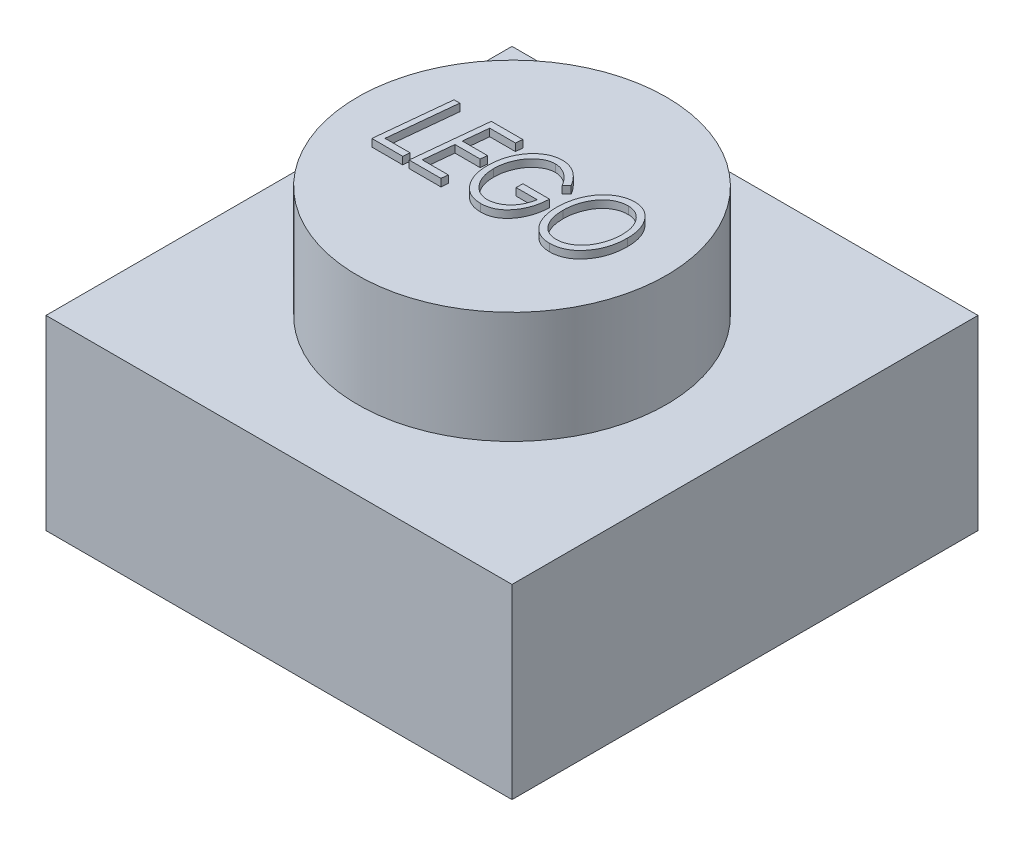
from build123d import *

# Parameters (mm, degrees)
SKETCH2_W           = 7.9375
SKETCH2_H           = 7.9375
BOSS_EXTRUDE3_DEPTH = 3.175
SKETCH3_R           = 2.630752939
BOSS_EXTRUDE4_DEPTH = 1.905
SHELL1_OUTLINE_W    = 4.8895
SHELL1_OUTLINE_H    = 4.8895
SHELL1_DEPTH        = 2.1082
SHELL1_START        = 2.1082
SHELL1_2_OUTLINE_R  = 1.106752939
SHELL1_2_DEPTH      = 1.4478
BOSS_EXTRUDE5_DEPTH = 0.127


# Read off the part's stored shape, not the designer's step: Shell1
with BuildPart() as part:
    # Sketch2 → Boss-Extrude3 (new body)
    with BuildSketch(Plane(origin=(0, 0, 0), x_dir=(1, 0, 0), z_dir=(0, 1, 0))):
        with Locations((-5.826863381, 4.754641089)):
            Rectangle(SKETCH2_W, SKETCH2_H)
    extrude(amount=BOSS_EXTRUDE3_DEPTH)

    # Sketch3 → Boss-Extrude4 (add)
    with BuildSketch(Plane(origin=(0, 3.175, 0), x_dir=(1, 0, 0), z_dir=(0, 1, 0))):
        with Locations(Location((-5.826863381, 4.754641089, 0), (0, 0, 90))):
            Circle(SKETCH3_R)
    extrude(amount=BOSS_EXTRUDE4_DEPTH)

    # Shell1 outline → Shell1 (cut)
    with BuildSketch(Plane(origin=(0, 0, 0), x_dir=(1, 0, 0), z_dir=(0, 1, 0))):
        with Locations((-5.826863381, 4.754641089)):
            Rectangle(SHELL1_OUTLINE_W, SHELL1_OUTLINE_H)
    extrude(amount=SHELL1_DEPTH, mode=Mode.SUBTRACT)

    # Shell1 2 outline → Shell1 2 (cut)
    with BuildSketch(Plane(origin=(0, 0, 0), x_dir=(1, 0, 0), z_dir=(0, 1, 0)).offset(SHELL1_START)):
        with Locations((-5.826863381, 4.754641089)):
            Circle(SHELL1_2_OUTLINE_R)
    extrude(amount=SHELL1_2_DEPTH, mode=Mode.SUBTRACT)

    # Sketch4 → Boss-Extrude5 (add)
    # profile 1 of 4: a face of its own
    with BuildSketch(Plane(origin=(0, 5.08, 0), x_dir=(1, 0, 0), z_dir=(0, 1, 0))):
        Polygon((-7.469023625, 5.408916057), (-7.370568096, 5.408916057), (-7.488358561, 4.252890416), (-7.061209122, 4.252890416), (-7.072403032, 4.138916057), (-7.598516814, 4.138916057), align=None)
    # profile 2 of 4: a face of its own
    with BuildSketch(Plane(origin=(0, 5.08, 0), x_dir=(1, 0, 0), z_dir=(0, 1, 0))):
        Polygon((-6.295952712, 5.408916057), (-6.309945099, 5.294941698), (-6.746762006, 5.294941698), (-6.790011205, 4.871608365), (-6.361080917, 4.871608365), (-6.373801269, 4.757634006), (-6.801713929, 4.757634006), (-6.853104154, 4.252890416), (-6.40992707, 4.252890416), (-6.421375388, 4.138916057), (-6.963516814, 4.138916057), (-6.833769218, 5.408916057), align=None)
    # profile 3 of 4: a face of its own
    with BuildSketch(Plane(origin=(0, 5.08, 0), x_dir=(1, 0, 0), z_dir=(0, 1, 0))):
        with BuildLine():
            Line((-5.205055276, 5.141534246), (-5.283921462, 5.06699298))
            add(Edge.make_bspline(
                [(-5.283921462, 5.06699298), (-5.290104061, 5.07722759), (-5.302283249, 5.097388887), (-5.321911615, 5.126229546), (-5.342472678, 5.153073955), (-5.363736434, 5.17825147), (-5.385749555, 5.201594989), (-5.408655739, 5.223056947), (-5.432517977, 5.242399102), (-5.456769584, 5.260250052), (-5.481725996, 5.275967669), (-5.506815494, 5.289789213), (-5.532245701, 5.301212479), (-5.557632909, 5.311042373), (-5.58334983, 5.318444542), (-5.609255489, 5.323396903), (-5.635157473, 5.326997472), (-5.652545024, 5.32733677), (-5.661207119, 5.327505801)],
                knots=[0, 0, 0, 0, 1.196282981, 2.356574207, 3.488564833, 4.578295718, 5.652722503, 6.697350663, 7.716475395, 8.724625629, 9.708632838, 10.665522288, 11.588281453, 12.496014935, 13.387662652, 14.261323447, 15.133829697, 16, 16, 16, 16], degree=3))
            add(Edge.make_bspline(
                [(-5.661207119, 5.327505801), (-5.67088473, 5.327249736), (-5.690313993, 5.326735647), (-5.719310325, 5.322913495), (-5.747903622, 5.316079298), (-5.776345839, 5.307295821), (-5.804339917, 5.29540579), (-5.832116421, 5.28120807), (-5.859441537, 5.264153407), (-5.886528567, 5.245059702), (-5.91249389, 5.223477777), (-5.937334281, 5.200228137), (-5.960666092, 5.175301799), (-5.98277822, 5.148759929), (-6.002939901, 5.120153543), (-6.022179954, 5.090137962), (-6.039655157, 5.058299391), (-6.055634059, 5.024978764), (-6.07008312, 4.990625642), (-6.082576678, 4.955463075), (-6.093009764, 4.919680207), (-6.101656833, 4.883251672), (-6.108567132, 4.846161738), (-6.113380385, 4.808449693), (-6.116210788, 4.770143678), (-6.116635791, 4.744409508), (-6.116850147, 4.731430079)],
                knots=[0, 0, 0, 0, 0.843012875, 1.692475334, 2.541905666, 3.401745525, 4.282593064, 5.187916219, 6.116688591, 7.086286462, 8.072875803, 9.05547398, 10.04851475, 11.045504879, 12.062333777, 13.095271912, 14.150091164, 15.22398608, 16.313397049, 17.395267012, 18.472992251, 19.558890601, 20.655790735, 21.758150586, 22.869288426, 24, 24, 24, 24], degree=3))
            add(Edge.make_bspline(
                [(-6.116850147, 4.731430079), (-6.11654513, 4.714029216), (-6.115945348, 4.679812399), (-6.110105191, 4.62947171), (-6.101039185, 4.581064318), (-6.088378695, 4.534531074), (-6.071713839, 4.490151157), (-6.051637369, 4.44765701), (-6.027477249, 4.407355452), (-6.000372976, 4.36930641), (-5.970577474, 4.334539362), (-5.938679404, 4.304140812), (-5.905309266, 4.278143978), (-5.87002816, 4.257167409), (-5.833385101, 4.240293242), (-5.794768731, 4.229088003), (-5.754872199, 4.221502419), (-5.727643297, 4.220721398), (-5.713869378, 4.220326313)],
                knots=[0, 0, 0, 0, 1.15626914, 2.273671612, 3.363767268, 4.427722549, 5.474773644, 6.511087033, 7.547446416, 8.593951096, 9.613198047, 10.586075472, 11.51852633, 12.418567772, 13.309168454, 14.191956699, 15.085389415, 16, 16, 16, 16], degree=3))
            add(Edge.make_bspline(
                [(-5.713869378, 4.220326313), (-5.697187603, 4.220905652), (-5.663832701, 4.22206403), (-5.614650713, 4.23326665), (-5.566267141, 4.249933158), (-5.519882859, 4.274000815), (-5.476043465, 4.303385527), (-5.435882312, 4.337444699), (-5.400511467, 4.376439678), (-5.369082234, 4.419720836), (-5.342539999, 4.468408398), (-5.319108562, 4.521809202), (-5.300509309, 4.580856738), (-5.291242478, 4.622297438), (-5.286465532, 4.643659647)],
                knots=[0, 0, 0, 0, 0.916786686, 1.833098046, 2.763036697, 3.727381392, 4.699521467, 5.662883065, 6.617613641, 7.590425702, 8.599518886, 9.663421742, 10.795520479, 12, 12, 12, 12], degree=3))
            Line((-5.286465532, 4.643659647), (-5.64467066, 4.643659647))
            Line((-5.64467066, 4.643659647), (-5.64467066, 4.757634006))
            Line((-5.64467066, 4.757634006), (-5.188773224, 4.757634006))
            add(Edge.make_bspline(
                [(-5.188773224, 4.757634006), (-5.190287961, 4.733938582), (-5.193252422, 4.68756472), (-5.203541235, 4.619971411), (-5.216950505, 4.55567703), (-5.235099874, 4.494958058), (-5.257259686, 4.437679786), (-5.283524309, 4.383785271), (-5.313825311, 4.333241067), (-5.348026971, 4.286532903), (-5.385481713, 4.244503435), (-5.425291332, 4.207484526), (-5.467510263, 4.176224664), (-5.511981499, 4.150475464), (-5.559002706, 4.130876407), (-5.608096978, 4.116467316), (-5.659552014, 4.107927002), (-5.694587648, 4.106881694), (-5.712342936, 4.106351954)],
                knots=[0, 0, 0, 0, 1.230099945, 2.407405095, 3.540169603, 4.631810963, 5.688013947, 6.720024631, 7.735380899, 8.738447696, 9.715948792, 10.649081929, 11.551021957, 12.433112901, 13.305757671, 14.18482106, 15.08010731, 16, 16, 16, 16], degree=3))
            add(Edge.make_bspline(
                [(-5.712342936, 4.106351954), (-5.730526507, 4.106859942), (-5.766246129, 4.107857829), (-5.818440168, 4.116604068), (-5.868136783, 4.130148798), (-5.915133226, 4.149814302), (-5.959624119, 4.174681854), (-6.001051975, 4.205772235), (-6.040221783, 4.241720516), (-6.076094548, 4.283179208), (-6.108361068, 4.328831506), (-6.137075677, 4.377468244), (-6.160983775, 4.429173395), (-6.180623613, 4.483570604), (-6.195895005, 4.54085648), (-6.206781228, 4.60091487), (-6.213163468, 4.663874139), (-6.214076237, 4.706737933), (-6.214542455, 4.728631602)],
                knots=[0, 0, 0, 0, 0.975454854, 1.916173571, 2.832872155, 3.734906809, 4.643978213, 5.561716061, 6.50885614, 7.492940325, 8.498387191, 9.506314525, 10.520544187, 11.551572611, 12.60720977, 13.699213744, 14.824820498, 16, 16, 16, 16], degree=3))
            add(Edge.make_bspline(
                [(-6.214542455, 4.728631602), (-6.214253301, 4.74440936), (-6.213679042, 4.775743895), (-6.210449306, 4.822302088), (-6.204500487, 4.868057185), (-6.196342043, 4.912951961), (-6.186228481, 4.957253482), (-6.17349003, 5.000635572), (-6.15842059, 5.043253117), (-6.141223509, 5.084801903), (-6.121937151, 5.124885448), (-6.10091558, 5.16310858), (-6.077853782, 5.198991658), (-6.053551918, 5.233061779), (-6.027006938, 5.264533915), (-5.998904187, 5.293864038), (-5.969385783, 5.321323966), (-5.937892187, 5.34610306), (-5.90519074, 5.368350171), (-5.871948756, 5.388141686), (-5.837811155, 5.404423606), (-5.803180475, 5.418078873), (-5.767714656, 5.428387358), (-5.731793865, 5.436212099), (-5.69514934, 5.44052963), (-5.670545758, 5.441161779), (-5.658154234, 5.44148016)],
                knots=[0, 0, 0, 0, 1.13454731, 2.253204348, 3.353632483, 4.450388651, 5.533088072, 6.619421413, 7.69938737, 8.781932251, 9.850998793, 10.896309048, 11.916272058, 12.916431651, 13.903249821, 14.873597862, 15.835865941, 16.799581839, 17.751751164, 18.678292444, 19.578269812, 20.468277126, 21.351932928, 22.230927165, 23.109011524, 24, 24, 24, 24], degree=3))
            add(Edge.make_bspline(
                [(-5.658154234, 5.44148016), (-5.646953193, 5.441195262), (-5.624758121, 5.440630732), (-5.591827356, 5.437349449), (-5.55964799, 5.431537462), (-5.528294638, 5.422908457), (-5.497377629, 5.412678129), (-5.467304168, 5.399469774), (-5.437793322, 5.384348225), (-5.409192229, 5.366537193), (-5.381070091, 5.346779422), (-5.353999081, 5.324166449), (-5.327069334, 5.299816206), (-5.301237697, 5.272722481), (-5.275898843, 5.243431839), (-5.251709732, 5.21150039), (-5.227506662, 5.177703788), (-5.212638002, 5.153750139), (-5.205055276, 5.141534246)],
                knots=[0, 0, 0, 0, 0.943484828, 1.869532845, 2.784357302, 3.69395279, 4.606460066, 5.524624326, 6.457423694, 7.397007344, 8.360158302, 9.349670338, 10.365838612, 11.416537512, 12.500361851, 13.626091713, 14.789353189, 16, 16, 16, 16], degree=3))
        make_face()
    # profile 4 of 4: a face of its own
    with BuildSketch(Plane(origin=(0, 5.08, 0), x_dir=(1, 0, 0), z_dir=(0, 1, 0))):
        with BuildLine():
            add(Edge.make_bspline(
                [(-4.416393417, 5.44148016), (-4.400077855, 5.441028169), (-4.367927652, 5.44013751), (-4.320782961, 5.431967305), (-4.275715362, 5.418815071), (-4.232924023, 5.399957664), (-4.192140037, 5.376150506), (-4.153542642, 5.346858186), (-4.117117087, 5.312331849), (-4.083237554, 5.27295534), (-4.052381462, 5.229713812), (-4.025302841, 5.18321033), (-4.002428309, 5.133950561), (-3.983425141, 5.082004255), (-3.968955667, 5.027143636), (-3.959062317, 4.969494829), (-3.95233803, 4.909164267), (-3.951675809, 4.867980991), (-3.951337327, 4.846930881)],
                knots=[0, 0, 0, 0, 0.93029012, 1.833158828, 2.721162925, 3.603055463, 4.494349206, 5.409836337, 6.361401369, 7.352815985, 8.369231504, 9.38835003, 10.418766484, 11.46425101, 12.540511606, 13.651054461, 14.799377575, 16, 16, 16, 16], degree=3))
            add(Edge.make_bspline(
                [(-3.951337327, 4.846930881), (-3.951792525, 4.821300517), (-3.952687083, 4.770931555), (-3.960717691, 4.69699902), (-3.973986669, 4.626259304), (-3.992109919, 4.558463107), (-4.016336319, 4.494038769), (-4.044880003, 4.43229779), (-4.079575848, 4.374162895), (-4.118704238, 4.319595038), (-4.161453262, 4.269600425), (-4.207752167, 4.22609291), (-4.25655898, 4.189118367), (-4.308020696, 4.158833594), (-4.362090237, 4.135240654), (-4.418779766, 4.118328166), (-4.478189252, 4.108197192), (-4.518710482, 4.106973094), (-4.539272022, 4.106351954)],
                knots=[0, 0, 0, 0, 1.168804584, 2.296942631, 3.387120815, 4.449326435, 5.493317731, 6.522913932, 7.547842027, 8.576209536, 9.582724426, 10.543235301, 11.468486263, 12.370050907, 13.260426965, 14.152582501, 15.062571622, 16, 16, 16, 16], degree=3))
            add(Edge.make_bspline(
                [(-4.539272022, 4.106351954), (-4.556684004, 4.106822587), (-4.590749717, 4.107743357), (-4.640547764, 4.115496222), (-4.68752054, 4.128551684), (-4.732056811, 4.146373991), (-4.773738144, 4.169797079), (-4.812886453, 4.198173568), (-4.849190215, 4.231794721), (-4.882414532, 4.270274372), (-4.912268783, 4.312843631), (-4.938257506, 4.358923454), (-4.960547372, 4.407989993), (-4.978575529, 4.46039249), (-4.992500894, 4.515903589), (-5.002288815, 4.574524022), (-5.008592575, 4.636229005), (-5.009305604, 4.678497462), (-5.00967066, 4.700138012)],
                knots=[0, 0, 0, 0, 0.982236231, 1.921698429, 2.835467506, 3.728601245, 4.622004199, 5.526616524, 6.451199518, 7.407885919, 8.390390261, 9.380511031, 10.389296484, 11.427540981, 12.50351622, 13.615222379, 14.779044621, 16, 16, 16, 16], degree=3))
            add(Edge.make_bspline(
                [(-5.00967066, 4.700138012), (-5.009416368, 4.717020667), (-5.008912333, 4.750483976), (-5.005186845, 4.800140642), (-4.999582334, 4.848857918), (-4.990684063, 4.896329457), (-4.980134028, 4.942932446), (-4.966850215, 4.988338729), (-4.951372437, 5.032815662), (-4.933236722, 5.075869313), (-4.913445157, 5.117493655), (-4.891065574, 5.156754289), (-4.867343623, 5.193953955), (-4.841400792, 5.228649543), (-4.814079995, 5.261380109), (-4.784389194, 5.291388966), (-4.753057475, 5.319219434), (-4.719985155, 5.344631079), (-4.685648274, 5.367500954), (-4.649997453, 5.387136406), (-4.61352205, 5.404102047), (-4.57598615, 5.417797516), (-4.537403714, 5.428264386), (-4.497961984, 5.435906162), (-4.457466871, 5.44061054), (-4.430143814, 5.441189032), (-4.416393417, 5.44148016)],
                knots=[0, 0, 0, 0, 1.149932427, 2.27929457, 3.390621263, 4.488580283, 5.56757729, 6.644360713, 7.709490428, 8.773742538, 9.825314013, 10.847077274, 11.850168115, 12.828757391, 13.796217691, 14.752087896, 15.701477552, 16.648932009, 17.591017608, 18.508954647, 19.418766979, 20.328854358, 21.22715008, 22.139160471, 23.063527813, 24, 24, 24, 24], degree=3))
        make_face()
        with BuildLine():
            add(Edge.make_bspline(
                [(-4.417665452, 5.327505801), (-4.429381308, 5.327282185), (-4.452452665, 5.326841831), (-4.486595702, 5.322712669), (-4.519873946, 5.316948927), (-4.552070762, 5.307696046), (-4.583486962, 5.296806327), (-4.613608715, 5.282381067), (-4.643154464, 5.26635687), (-4.671393081, 5.247393261), (-4.698343178, 5.22620896), (-4.724173431, 5.203075147), (-4.74831049, 5.177548602), (-4.770982599, 5.149929652), (-4.792386745, 5.120415518), (-4.81232613, 5.088744157), (-4.830521479, 5.054805622), (-4.847503615, 5.019180217), (-4.862686225, 4.982146034), (-4.875991158, 4.944309454), (-4.886796351, 4.905749434), (-4.896063337, 4.86682455), (-4.903198064, 4.827247352), (-4.908237256, 4.787079409), (-4.911406784, 4.746236843), (-4.911786812, 4.718800274), (-4.911978353, 4.704971746)],
                knots=[0, 0, 0, 0, 0.952835714, 1.876364321, 2.795319121, 3.697647925, 4.599026464, 5.497336202, 6.41148601, 7.3319938, 8.260945374, 9.19900091, 10.150736697, 11.11637805, 12.104608135, 13.115416731, 14.158972426, 15.236136431, 16.325300306, 17.414223732, 18.49755812, 19.582100424, 20.668923115, 21.767835175, 22.874948508, 24, 24, 24, 24], degree=3))
            add(Edge.make_bspline(
                [(-4.911978353, 4.704971746), (-4.9113757, 4.681963748), (-4.910199315, 4.63705187), (-4.901497131, 4.571479244), (-4.886763615, 4.509579536), (-4.869462931, 4.460885023), (-4.853086091, 4.424226346), (-4.839687548, 4.398493824), (-4.824847649, 4.374669989), (-4.80931389, 4.352274476), (-4.792457958, 4.331625012), (-4.77445721, 4.312546466), (-4.755238865, 4.295212528), (-4.735141157, 4.27929055), (-4.713834565, 4.265364636), (-4.691572857, 4.25339341), (-4.668481728, 4.243076147), (-4.644401978, 4.234708734), (-4.619352413, 4.228395296), (-4.593510206, 4.22380335), (-4.566726971, 4.220943186), (-4.548522582, 4.22053416), (-4.539272022, 4.220326313)],
                knots=[0, 0, 0, 0, 2.013464579, 3.930306141, 5.777416628, 7.573366671, 8.443825166, 9.290444136, 10.110284435, 10.898956244, 11.674490529, 12.441057559, 13.192490265, 13.937886677, 14.683135251, 15.417098583, 16.148128606, 16.894595964, 17.645295135, 18.406778463, 19.190404515, 20, 20, 20, 20], degree=3))
            add(Edge.make_bspline(
                [(-4.539272022, 4.220326313), (-4.528232255, 4.220534025), (-4.506330262, 4.220946109), (-4.473883627, 4.225377173), (-4.441980488, 4.231479189), (-4.410821229, 4.240865147), (-4.380122235, 4.252506846), (-4.350220852, 4.267144356), (-4.320694982, 4.283963791), (-4.292122205, 4.303567643), (-4.264463859, 4.325366796), (-4.238170264, 4.349247846), (-4.213819136, 4.375447566), (-4.190410994, 4.403165184), (-4.168994194, 4.433265359), (-4.148621633, 4.46510778), (-4.13057721, 4.499351522), (-4.113430296, 4.535063999), (-4.098336417, 4.572309857), (-4.084971717, 4.610464999), (-4.074179607, 4.649541444), (-4.064949401, 4.689153617), (-4.057786215, 4.729573704), (-4.052774628, 4.770677739), (-4.049593989, 4.812620474), (-4.049219109, 4.840819395), (-4.049029635, 4.855071906)],
                knots=[0, 0, 0, 0, 0.893035767, 1.771709689, 2.64675632, 3.519916202, 4.402095681, 5.301650428, 6.21182836, 7.150474918, 8.103543687, 9.060756467, 10.022266933, 10.996967727, 11.995240975, 13.010295067, 14.054501085, 15.126100034, 16.21598917, 17.305770216, 18.396718074, 19.495713188, 20.597192297, 21.717672602, 22.846448839, 24, 24, 24, 24], degree=3))
            add(Edge.make_bspline(
                [(-4.049029635, 4.855071906), (-4.049451141, 4.873571647), (-4.050274869, 4.909724702), (-4.055797691, 4.962510163), (-4.065452116, 5.01230372), (-4.078952047, 5.059151233), (-4.096215016, 5.103089301), (-4.117480978, 5.144117395), (-4.142578858, 5.182242207), (-4.162325418, 5.205164852), (-4.172162647, 5.216584326)],
                knots=[0, 0, 0, 0, 1.135306921, 2.218669767, 3.2526033, 4.24413341, 5.206694718, 6.144759284, 7.075766655, 8, 8, 8, 8], degree=3))
            add(Edge.make_bspline(
                [(-4.172162647, 5.216584326), (-4.180737036, 5.22540371), (-4.197589338, 5.242737534), (-4.225205091, 5.265422741), (-4.25405677, 5.284696692), (-4.284317339, 5.300255209), (-4.315801721, 5.312673285), (-4.348692027, 5.321224193), (-4.382813451, 5.326458375), (-4.405944003, 5.32715353), (-4.417665452, 5.327505801)],
                knots=[0, 0, 0, 0, 1.062477457, 2.088217907, 3.082280623, 4.055893984, 5.023640818, 6.001438705, 6.987225448, 8, 8, 8, 8], degree=3))
        make_face(mode=Mode.SUBTRACT)
    extrude(amount=BOSS_EXTRUDE5_DEPTH)


solid = part.part
